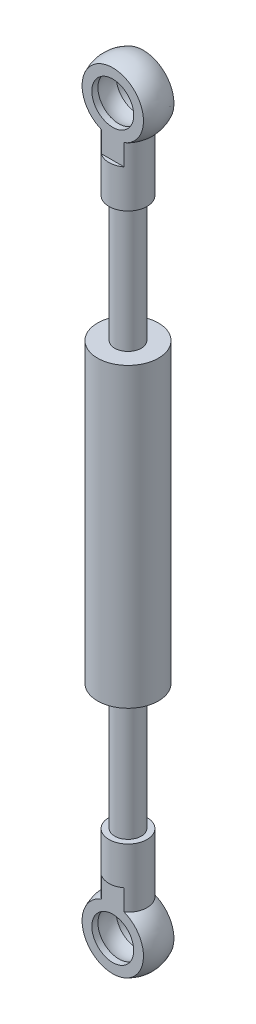
from build123d import *

# Parameters (mm, degrees)
CUT_EXTRUDE_1_DEPTH      = 53.38797572
CUT_EXTRUDE_1_DEPTH_BACK = 53.38797572
SKETCH_3_W               = 3
SKETCH_3_H               = 15
CUT_EXTRUDE_2_DEPTH      = 53.538081427
CUT_EXTRUDE_2_DEPTH_BACK = 53.538081427
SKETCH_4_R               = 2.75


with BuildPart() as part:
    # 草圖1 → 旋轉1 (revolve)
    with BuildSketch(Plane.XY):
        with BuildLine():
            ThreePointArc((2.5, 43.758342613), (4.30624304, 48.80624304), (0, 52))
            Line((0, 52), (0, -52))
            ThreePointArc((0, -52), (4.30624304, -48.80624304), (2.5, -43.758342613))
            Line((2.5, -43.758342613), (2.5, -36))
            Line((2.5, -36), (1.75, -36))
            Line((1.75, -36), (1.75, -19.5))
            Line((1.75, -19.5), (4, -19.5))
            Line((4, -19.5), (4, 19.5))
            Line((4, 19.5), (1.75, 19.5))
            Line((1.75, 19.5), (1.75, 36))
            Line((1.75, 36), (2.5, 36))
            Line((2.5, 36), (2.5, 43.758342613))
        make_face()
    revolve(axis=Axis((0, -1000, 0), (0, 1, 0)))

    # 草圖2 → 除料-旋轉1 (revolve, cut)
    with BuildSketch(Plane.XY):
        with BuildLine():
            Line((0, 50.5), (0, 44.5))
            ThreePointArc((0, 44.5), (3, 47.5), (0, 50.5))
        make_face()
        with BuildLine():
            Line((0, -44.5), (0, -50.5))
            ThreePointArc((0, -50.5), (3, -47.5), (0, -44.5))
        make_face()
    revolve(axis=Axis((0, -1000, 0), (0, 1, 0)), mode=Mode.SUBTRACT)

    # 草圖3 → 除料-伸長1 (cut, two sides: drawn at the far end of the back side and taken through both)
    with BuildSketch(Plane(origin=(0, 0, 0), x_dir=(0, 0, -1), z_dir=(1, 0, 0)).offset(-CUT_EXTRUDE_1_DEPTH_BACK)):
        with Locations((-3.5, 48.5)):
            Rectangle(SKETCH_3_W, SKETCH_3_H)
        with Locations((3.5, 48.5)):
            Rectangle(SKETCH_3_W, SKETCH_3_H)
        with Locations((3.5, -48.5)):
            Rectangle(SKETCH_3_W, SKETCH_3_H)
        with Locations((-3.5, -48.5)):
            Rectangle(SKETCH_3_W, SKETCH_3_H)
    extrude(amount=CUT_EXTRUDE_1_DEPTH + CUT_EXTRUDE_1_DEPTH_BACK, mode=Mode.SUBTRACT)

    # 草圖4 → 除料-伸長2 (cut, two sides: drawn at the far end of the back side and taken through both)
    with BuildSketch(Plane.XY.offset(2).offset(-CUT_EXTRUDE_2_DEPTH_BACK)):
        with Locations((0, 47.5)):
            Circle(SKETCH_4_R)
        with Locations((0, -47.5)):
            Circle(SKETCH_4_R)
    extrude(amount=CUT_EXTRUDE_2_DEPTH + CUT_EXTRUDE_2_DEPTH_BACK, mode=Mode.SUBTRACT)


solid = part.part
